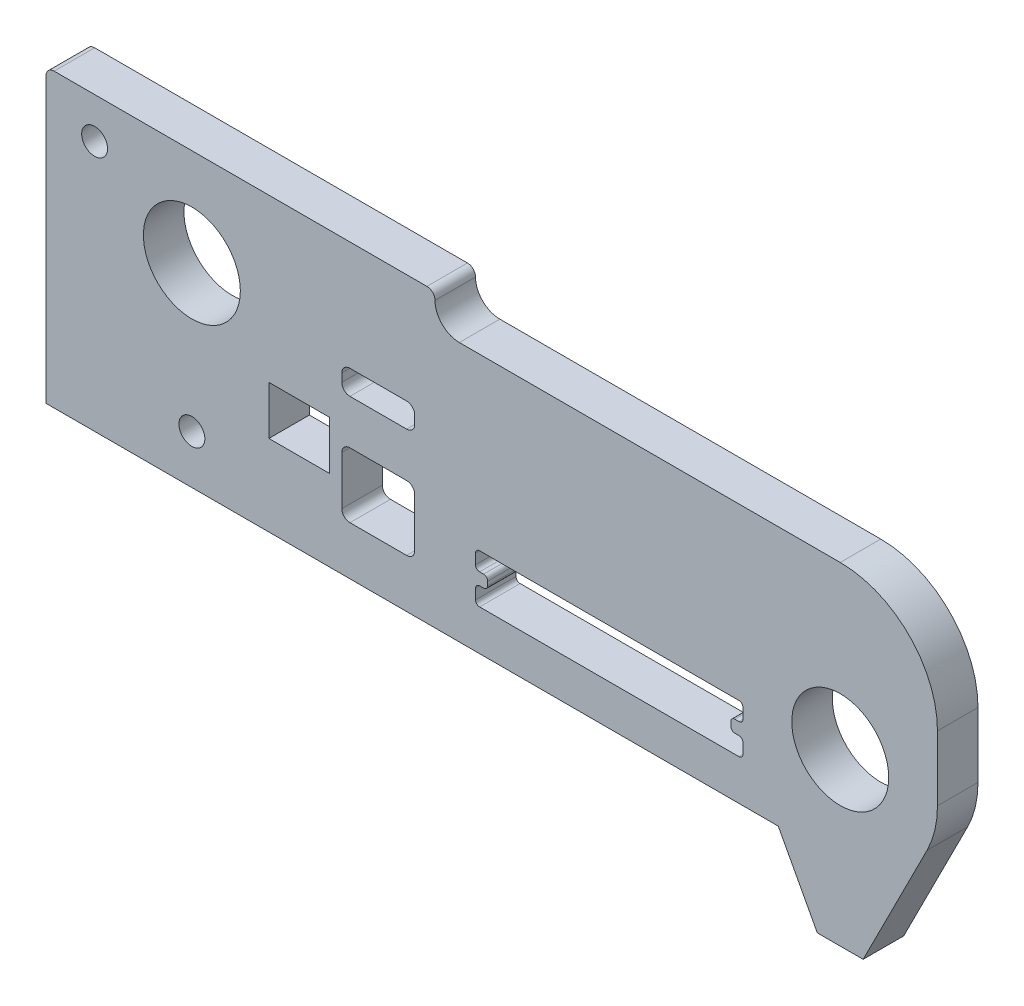
from build123d import *

# Parameters (mm, degrees)
SKETCH1_R           = 5.98
SKETCH1_R_2         = 1.6
SKETCH1_W           = 9
SKETCH1_H           = 8
SKETCH1_H_2         = 3
SKETCH1_W_2         = 7.5
SKETCH1_H_3         = 6
BOSS_EXTRUDE1_DEPTH = 5
FILLET1_R           = 1
FILLET2_R           = 3
FILLET3_R           = 1
CUT_EXTRUDE1_DEPTH  = 98.867257037
FILLET4_R           = 0.5


with BuildPart() as part:
    # Sketch1 → Boss-Extrude1 (new body)
    with BuildSketch(Plane.XY):
        with BuildLine():
            Line((72.356568311, -24), (77.172081726, -33))
            Line((77.172081726, -33), (82.827918274, -33))
            Line((82.827918274, -33), (90.70873293, -17.415075165))
            ThreePointArc((90.70873293, -17.415075165), (91.67272023, -14.78345153), (92, -12))
            Line((92, -12), (92, -4))
            ThreePointArc((92, -4), (88.485281374, 4.485281374), (80, 8))
            Line((80, 8), (30, 8))
            Line((30, 8), (30, 12))
            Line((30, 12), (-18, 12))
            Line((-18, 12), (-18, -24))
            Line((-18, -24), (72.356568311, -24))
        make_face()
        Circle(SKETCH1_R, mode=Mode.SUBTRACT)
        with Locations((80, -12)):
            Circle(SKETCH1_R, mode=Mode.SUBTRACT)
        with Locations((-12, 7)):
            Circle(SKETCH1_R_2, mode=Mode.SUBTRACT)
        with Locations((0, -18)):
            Circle(SKETCH1_R_2, mode=Mode.SUBTRACT)
        with Locations((23, -14)):
            Rectangle(SKETCH1_W, SKETCH1_H, mode=Mode.SUBTRACT)
        with Locations((23, -3)):
            Rectangle(SKETCH1_W, SKETCH1_H_2, mode=Mode.SUBTRACT)
        with Locations((13.25, -11)):
            Rectangle(SKETCH1_W_2, SKETCH1_H_3, mode=Mode.SUBTRACT)
    extrude(amount=BOSS_EXTRUDE1_DEPTH)

    # Fillet1
    fillet1_edges = [part.edges().sort_by_distance(p)[0] for p in [
        (18.5, -10, 2.5),
        (18.5, -18, 2.5),
        (27.5, -18, 2.5),
        (27.5, -10, 2.5),
        (18.5, -1.5, 2.5),
        (18.5, -4.5, 2.5),
        (27.5, -4.5, 2.5),
        (27.5, -1.5, 2.5),
    ]]
    fillet(fillet1_edges, radius=FILLET1_R)

    # Fillet2
    fillet2_edges = [part.edges().sort_by_distance(p)[0] for p in [
        (30, 8, 2.5),
    ]]
    fillet(fillet2_edges, radius=FILLET2_R)

    # Fillet3
    fillet3_edges = [part.edges().sort_by_distance(p)[0] for p in [
        (30, 12, 2.5),
        (-18, 12, 2.5),
    ]]
    fillet(fillet3_edges, radius=FILLET3_R - 0.0001)  # a hair under: the kernel refuses the full size

    # Sketch2 → Cut-Extrude1 (cut, through all)
    with BuildSketch(Plane.XY.offset(5)):
        Polygon((35, -13), (68, -13), (68, -15.25), (66.5, -15.25), (66.5, -16.75), (68, -16.75), (68, -19), (35, -19), (35, -16.75), (36.5, -16.75), (36.5, -15.25), (35, -15.25), align=None)
    extrude(amount=-CUT_EXTRUDE1_DEPTH, mode=Mode.SUBTRACT)

    # Fillet4
    fillet4_edges = [part.edges().sort_by_distance(p)[0] for p in [
        (35, -15.25, 2.5),
        (35, -13, 2.5),
        (68, -13, 2.5),
        (68, -15.25, 2.5),
        (66.5, -15.25, 2.5),
        (66.5, -16.75, 2.5),
        (68, -16.75, 2.5),
        (68, -19, 2.5),
        (35, -19, 2.5),
        (35, -16.75, 2.5),
        (36.5, -16.75, 2.5),
        (36.5, -15.25, 2.5),
    ]]
    fillet(fillet4_edges, radius=FILLET4_R)


solid = part.part
